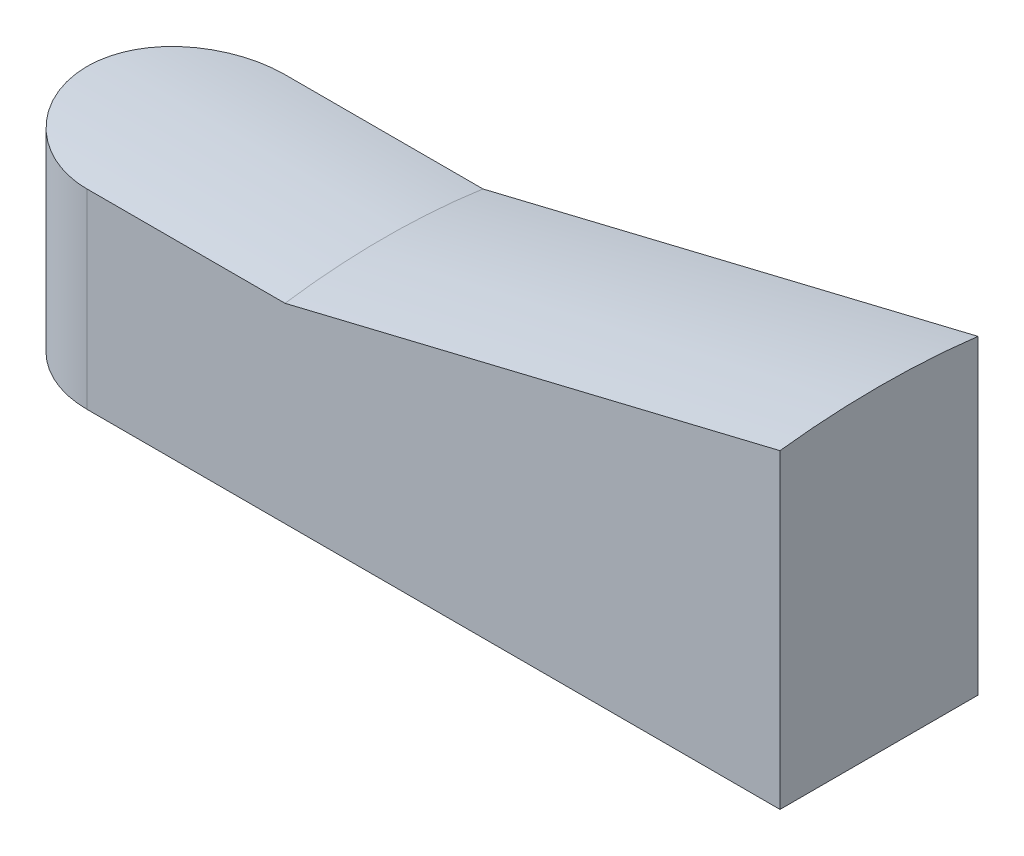
from build123d import *

# Parameters (mm, degrees)
REVOLVE1_ANGLE           = 50
REVOLVE1_OTHER_WAY_ANGLE = 50
CUT_EXTRUDE1_DEPTH       = 66.325732245
FILLET1_R                = 5


with BuildPart() as part:
    # Sketch1 → Revolve1 (revolve)
    with BuildSketch(Plane.XY):
        Polygon((40, 0), (40, 41), (15, 35), (0, 35), (0, 0), align=None)
    revolve(axis=Axis((0, 0, 0), (1, 0, 0)), revolution_arc=REVOLVE1_ANGLE)

    # Sketch1 → Revolve1 other way (revolve)
    with BuildSketch(Plane.XY):
        Polygon((40, 0), (40, 41), (15, 35), (0, 35), (0, 0), align=None)
    revolve(axis=Axis((0, 0, 0), (-1, 0, 0)), revolution_arc=REVOLVE1_OTHER_WAY_ANGLE)

    # Sketch2 → Cut-Extrude1 (cut, through all)
    with BuildSketch(Plane(origin=(40, 0, 0), x_dir=(0, 0, -1), z_dir=(1, 0, 0))):
        Polygon((5, 55), (5, 25), (-5, 25), (-5, 55), (-52.677102501, 31.854164121), (-43.180890272, -35.505504787), (23.482121539, -41.698119686), (44.635770916, -16.539288183), (46.488696352, -14.335534211), (49.453653338, 39.53478931), align=None)
    extrude(amount=-CUT_EXTRUDE1_DEPTH, mode=Mode.SUBTRACT)

    # Fillet1
    # the kernel refuses this fillet: 5 mm, written as the material it takes off along each edge
    with BuildSketch(Plane(origin=(0, 12.5, 5), x_dir=(1, 0, 0), z_dir=(0, 1, 0)), Plane(origin=(0, 47.141016151, -5), x_dir=(1, 0, 0), z_dir=(0, -1, 0))) as fillet1_piece_1:
        with BuildLine():
            CenterArc((FILLET1_R, FILLET1_R), FILLET1_R, 180, 90)
            Line((0, FILLET1_R), (0, 0))
            Line((0, 0), (FILLET1_R, 0))
        make_face()
    extrude(amount=34.641016151, mode=Mode.SUBTRACT)


solid = part.part
